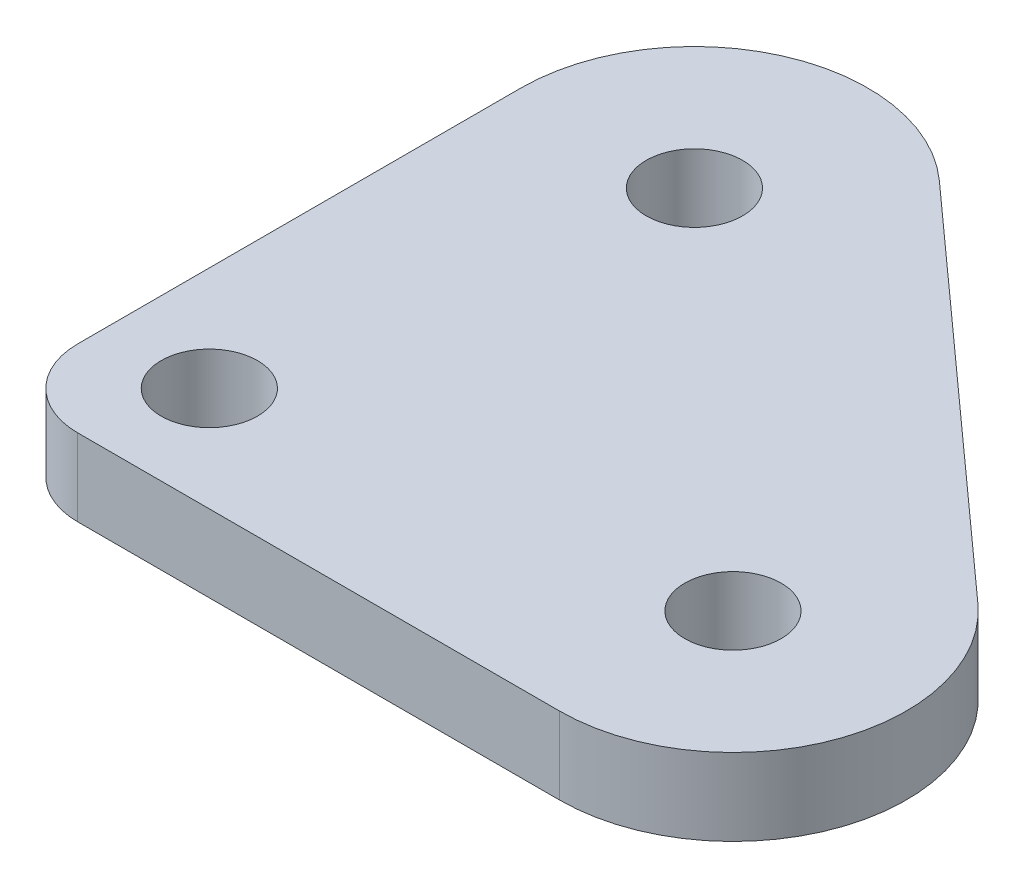
from build123d import *

# Parameters (mm, degrees)
SKETCH1_R           = 2.5
BOSS_EXTRUDE1_DEPTH = 4
FILLET1_R           = 4
SKETCH2_R           = 2.5
CUT_EXTRUDE1_DEPTH  = 4


with BuildPart() as part:
    # Sketch1 → Boss-Extrude1 (new body)
    with BuildSketch(Plane(origin=(0, 0, 0), x_dir=(1, 0, 0), z_dir=(0, 1, 0))):
        with BuildLine():
            ThreePointArc((6.020682585, 24.689647316), (-3.661547264, 26.22150057), (-9, 18))
            Line((-9, 18), (-9, -9))
            Line((-9, -9), (20, -9))
            ThreePointArc((20, -9), (28.402583705, -3.224373905), (26.020682585, 6.689647316))
            Line((26.020682585, 6.689647316), (6.020682585, 24.689647316))
        make_face()
        with Locations((0, 18)):
            Circle(SKETCH1_R, mode=Mode.SUBTRACT)
        with Locations((20, 0)):
            Circle(SKETCH1_R, mode=Mode.SUBTRACT)
    extrude(amount=BOSS_EXTRUDE1_DEPTH)

    # Fillet1
    fillet1_edges = [part.edges().sort_by_distance(p)[0] for p in [
        (-9, 2, 9),
    ]]
    fillet(fillet1_edges, radius=FILLET1_R)

    # Sketch2 → Cut-Extrude1 (cut)
    with BuildSketch(Plane.XZ):
        with Locations((-3.585786438, 3.585786438)):
            Circle(SKETCH2_R)
    extrude(amount=-CUT_EXTRUDE1_DEPTH, mode=Mode.SUBTRACT)


solid = part.part
